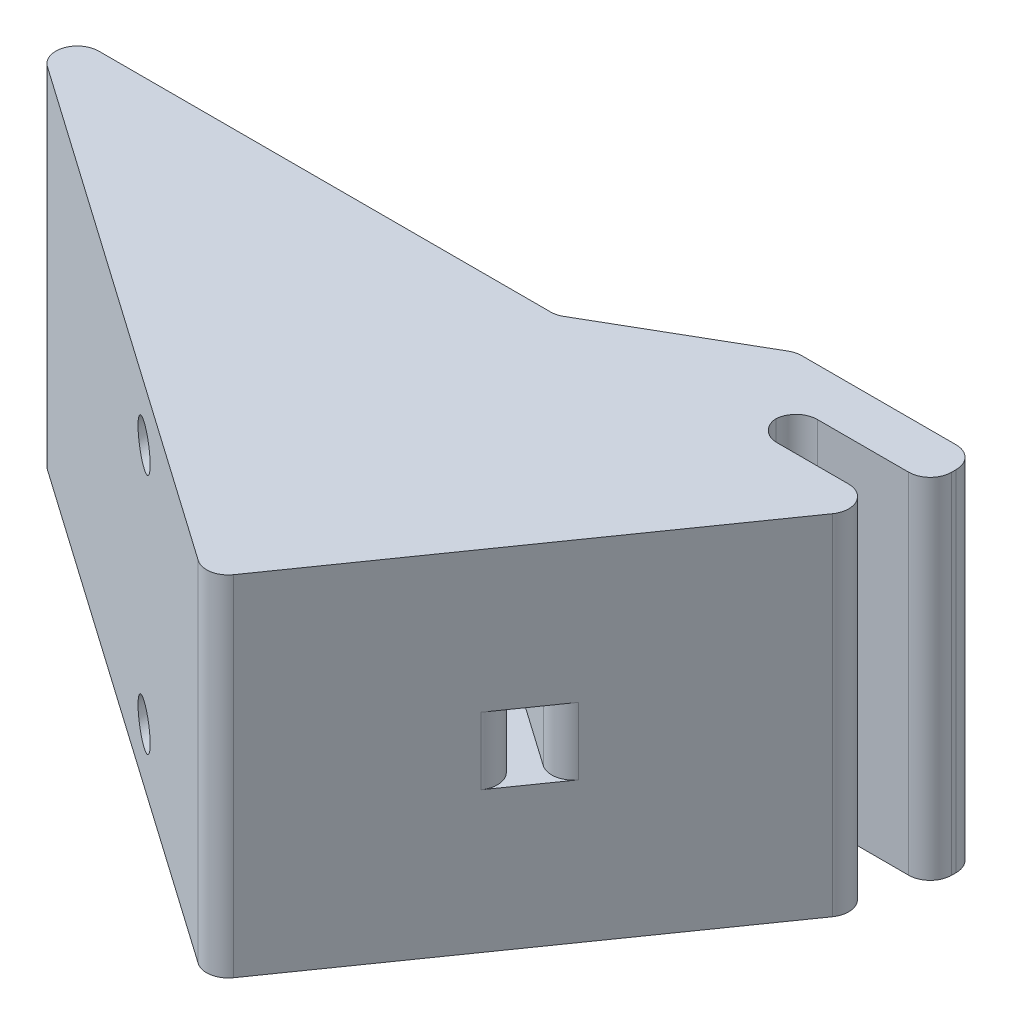
from build123d import *

# Parameters (mm, degrees)
BOSS_EXTRUDE1_DEPTH = 20.6375
BOSS_EXTRUDE2_DEPTH = 20.6375
CUT_EXTRUDE1_DEPTH  = 3.96875
FILLET1_R           = 2.54


with BuildPart() as part:
    # Sketch3 → Boss-Extrude1 (new, symmetric)
    with BuildSketch(Plane(origin=(0, 0, 0), x_dir=(1, 0, 0), z_dir=(0, 1, 0))):
        Polygon((0, 0), (-101.6, 0), (-33.425376719, -47.736385136), align=None)
    extrude(amount=BOSS_EXTRUDE1_DEPTH, both=True)

    # Sketch1 → Boss-Extrude2 (add, symmetric)
    with BuildSketch(Plane(origin=(0, 0, 0), x_dir=(1, 0, 0), z_dir=(0, 1, 0))):
        Polygon((-21.487660076, 10.375160076), (0, 10.375160076), (0, 4.7625), (-15.875, 4.7625), (-15.875, 0), (-39.457964463, 0), align=None)
    extrude(amount=BOSS_EXTRUDE2_DEPTH, both=True)

    # Sketch5 → Cut-Extrude1 (cut, symmetric)
    with BuildSketch(Plane(origin=(0, 0, 0), x_dir=(1, 0, 0), z_dir=(0, 1, 0))):
        Polygon((-56.064295192, 0), (-18.444588457, -26.341602241), (-16.623483272, -23.7407945), (-54.243190006, 2.600807741), align=None)
    extrude(amount=CUT_EXTRUDE1_DEPTH, both=True, mode=Mode.SUBTRACT)

    # Fillet1
    # the kernel refuses this fillet: 2.54 mm, written as the material it adds along each edge
    with BuildSketch(Plane(origin=(-15.875, 20.6375, -4.7625), x_dir=(0, 0, 1), z_dir=(0, -1, 0))) as fillet1_piece_1:
        with BuildLine():
            CenterArc((FILLET1_R, -FILLET1_R), FILLET1_R, 90, 90)
            Line((0, -FILLET1_R), (0, 0))
            Line((0, 0), (FILLET1_R, 0))
        make_face()
    extrude(amount=41.275)
    with BuildSketch(Plane(origin=(-15.875, -20.6375, 0), x_dir=(1, 0, 0), z_dir=(0, 1, 0))) as fillet1_piece_2:
        with BuildLine():
            CenterArc((FILLET1_R, FILLET1_R), FILLET1_R, 180, 90)
            Line((0, FILLET1_R), (0, 0))
            Line((0, 0), (FILLET1_R, 0))
        make_face()
    extrude(amount=41.275)
    with BuildSketch(Plane(origin=(-39.457964463, -20.6375, 0), x_dir=(0.8660254037844413, 0, -0.49999999999999567), z_dir=(0, 1, 0))) as fillet1_piece_3:
        with BuildLine():
            CenterArc((FILLET1_R * 0.267949192431, FILLET1_R), FILLET1_R, 240, 30)
            Line((-FILLET1_R * 0.232050807569, FILLET1_R * 0.133974596216), (0, 0))
            Line((0, 0), (FILLET1_R * 0.267949192431, 0))
        make_face()
    extrude(amount=41.275)
    # the kernel refuses this fillet: 2.54 mm, written as the material it takes off along each edge
    with BuildSketch(Plane(origin=(-56.064295192, 3.96875, 0), x_dir=(-1, 0, 0), z_dir=(0, -1, 0))) as fillet1_2_piece_1:
        with BuildLine():
            CenterArc((FILLET1_R * 0.315298788879, -FILLET1_R), FILLET1_R, 90, 35)
            Line((-FILLET1_R * 0.258277647472, -FILLET1_R * 0.180847955711), (0, 0))
            Line((0, 0), (FILLET1_R * 0.315298788879, 0))
        make_face()
    extrude(amount=7.9375, mode=Mode.SUBTRACT)
    with BuildSketch(Plane(origin=(-50.528851616, 3.96875, 0), x_dir=(1, 0, 0), z_dir=(0, -1, 0))) as fillet1_2_piece_2:
        with BuildLine():
            CenterArc((FILLET1_R * 3.17159480236, FILLET1_R), FILLET1_R, 125, 145)
            Line((FILLET1_R * 2.59801836601, FILLET1_R * 1.81915204429), (0, 0))
            Line((0, 0), (FILLET1_R * 3.17159480236, 0))
        make_face()
    extrude(amount=7.9375, mode=Mode.SUBTRACT)
    with BuildSketch(Plane(origin=(-18.444588457, -3.96875, 26.341602241), x_dir=(-0.5735764363510412, 0, 0.8191520442889952), z_dir=(0, 1, 0))) as fillet1_2_piece_3:
        with BuildLine():
            CenterArc((FILLET1_R, -FILLET1_R), FILLET1_R, 90, 90)
            Line((0, -FILLET1_R), (0, 0))
            Line((0, 0), (FILLET1_R, 0))
        make_face()
    extrude(amount=7.9375, mode=Mode.SUBTRACT)
    with BuildSketch(Plane(origin=(-16.623483272, -3.96875, 23.7407945), x_dir=(0.573576436351041, 0, -0.8191520442889954), z_dir=(0, 1, 0))) as fillet1_2_piece_4:
        with BuildLine():
            CenterArc((FILLET1_R, FILLET1_R), FILLET1_R, 180, 90)
            Line((0, FILLET1_R), (0, 0))
            Line((0, 0), (FILLET1_R, 0))
        make_face()
    extrude(amount=7.9375, mode=Mode.SUBTRACT)
    with BuildSketch(Plane(origin=(0, 32.835736506, 0), x_dir=(-1, 0, 0), z_dir=(0, -1, 0))) as fillet1_2_piece_5:
        with BuildLine():
            CenterArc((FILLET1_R * 1.92098212697, -FILLET1_R), FILLET1_R, 90, 125)
            Line((FILLET1_R * 1.10183008268, -FILLET1_R * 1.57357643635), (0, 0))
            Line((0, 0), (FILLET1_R * 1.92098212697, 0))
        make_face()
    extrude(amount=65.671473013, mode=Mode.SUBTRACT)
    with BuildSketch(Plane(origin=(0, 26.9875, -4.7625), x_dir=(-1, 0, 0), z_dir=(0, -1, 0)), Plane(origin=(0, 26.9875, -10.375160076), x_dir=(0, 0, 1), z_dir=(0, -1, 0))) as fillet1_2_piece_6:
        with BuildLine():
            CenterArc((FILLET1_R, FILLET1_R), FILLET1_R, 180, 90)
            Line((0, FILLET1_R), (0, 0))
            Line((0, 0), (FILLET1_R, 0))
        make_face()
    extrude(amount=53.975, mode=Mode.SUBTRACT)
    with BuildSketch(Plane(origin=(-21.487660076, -22.338977372, -10.375160076), x_dir=(1, 0, 0), z_dir=(0, 1, 0))) as fillet1_2_piece_7:
        with BuildLine():
            CenterArc((FILLET1_R * 0.267949192431, -FILLET1_R), FILLET1_R, 90, 30)
            Line((-FILLET1_R * 0.232050807569, -FILLET1_R * 0.133974596216), (0, 0))
            Line((0, 0), (FILLET1_R * 0.267949192431, 0))
        make_face()
    extrude(amount=44.677954744, mode=Mode.SUBTRACT)
    with BuildSketch(Plane(origin=(-33.425376719, 26.9875, 47.736385136), x_dir=(0.5735764363510407, 0, -0.8191520442889956), z_dir=(0, -1, 0))) as fillet1_2_piece_8:
        with BuildLine():
            CenterArc((FILLET1_R, -FILLET1_R), FILLET1_R, 90, 90)
            Line((0, -FILLET1_R), (0, 0))
            Line((0, 0), (FILLET1_R, 0))
        make_face()
    extrude(amount=53.975, mode=Mode.SUBTRACT)
    with BuildSketch(Plane(origin=(-101.6, -40.777126995, 0), x_dir=(1, 0, 0), z_dir=(0, 1, 0))) as fillet1_2_piece_9:
        with BuildLine():
            CenterArc((FILLET1_R * 3.17159480236, -FILLET1_R), FILLET1_R, 90, 145)
            Line((FILLET1_R * 2.59801836601, -FILLET1_R * 1.81915204429), (0, 0))
            Line((0, 0), (FILLET1_R * 3.17159480236, 0))
        make_face()
    extrude(amount=81.55425399, mode=Mode.SUBTRACT)

    # Sketch7 → Cut-Revolve1 (revolve, cut)
    with BuildSketch(Plane(origin=(-56.865154115, 0, 0), x_dir=(0, 0, -1), z_dir=(1, 0, 0)), mode=Mode.PRIVATE) as cut_revolve1_sk:
        Polygon((0, -18.415), (-1.049252856, -16.66875), (-46.738854795, -16.66875), (-46.738854795, -14.2875), (0, -14.2875), align=None)
    cut_revolve1 = revolve(cut_revolve1_sk.sketch.rotate(Axis((-56.865154115, -14.2875, 46.738854795), (0, 0, -1)), 270), axis=Axis((-56.865154115, -14.2875, 46.738854795), (0, 0, -1)), mode=Mode.SUBTRACT)

    # Mirror1: Cut-Revolve1 across plane
    add(cut_revolve1.mirror(Plane.ZX), mode=Mode.SUBTRACT)


solid = part.part
